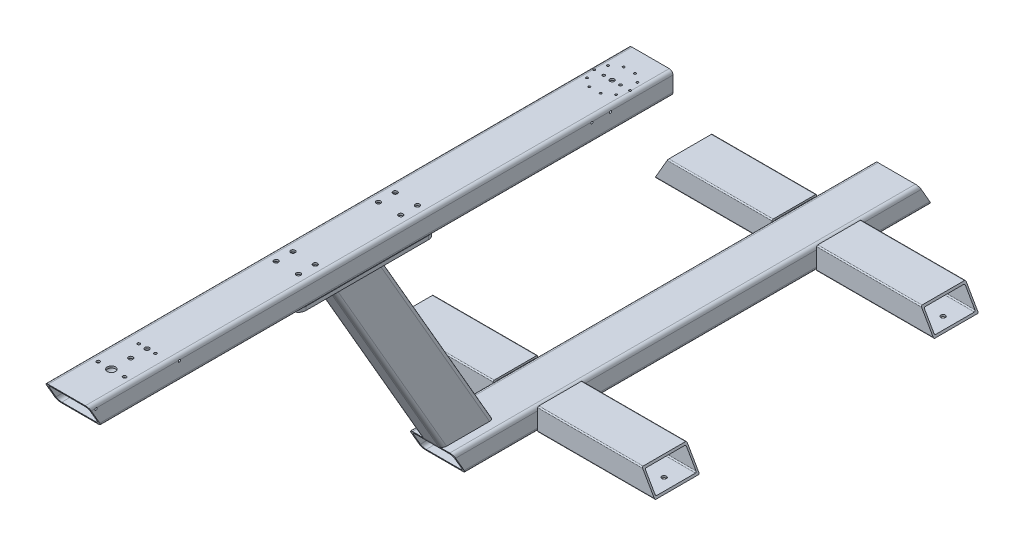
from build123d import *
from build123d.topology import SkipClean

# Parameters (mm, degrees)
CUSTOM_START                               = -800
CUSTOM_TUBE_RECTANGLE_120_60_5_1_DEPTH     = 1286.602540378
CUSTOM_START_2                             = -437
CUSTOM_TUBE_RECTANGLE_120_60_5_1_2_OUTLI_W = 122
CUSTOM_TUBE_RECTANGLE_120_60_5_1_2_OUTLI_H = 73
CUSTOM_TUBE_RECTANGLE_120_60_5_1_2_DEPTH   = 30.589838486
CUSTOM_START_3                             = -103.589838486
CUSTOM_TUBE_RECTANGLE_120_60_5_1_3_DEPTH   = 1570
CUSTOM_START_4                             = 269.282032303
CUSTOM_TUBE_RECTANGLE_120_60_5_1_4_DEPTH   = 554.256258422
CUSTOM_START_5                             = 200
CUSTOM_TUBE_RECTANGLE_120_60_5_1_5_DEPTH   = 69.282032303
CUSTOM_START_6                             = 823.538290725
CUSTOM_TUBE_RECTANGLE_120_60_5_1_6_DEPTH   = 69.282032303
CUSTOM_START_7                             = -31
CUSTOM_TUBE_RECTANGLE_120_60_5_1_7_OUTLI_W = 62
CUSTOM_TUBE_RECTANGLE_120_60_5_1_7_OUTLI_H = 453
CUSTOM_TUBE_RECTANGLE_120_60_5_1_7_DEPTH   = 61
CUSTOM_START_8                             = 570
CUSTOM_TUBE_RECTANGLE_120_60_5_1_8_OUTLI_W = 62
CUSTOM_TUBE_RECTANGLE_120_60_5_1_8_OUTLI_H = 453
CUSTOM_TUBE_RECTANGLE_120_60_5_1_8_DEPTH   = 61
CUSTOM_START_9                             = 199
CUSTOM_TUBE_RECTANGLE_120_60_5_1_9_DEPTH   = 695
CUSTOM_TUBE_RECTANGLE_120_60_5_2_DEPTH     = 750
CUSTOM_TUBE_RECTANGLE_120_60_5_2_2_DEPTH   = 750
AJUSTER_PROLONGER2_START                   = -60
AJUSTER_PROLONGER2_DEPTH                   = 435
AJUSTER_PROLONGER2_START_2                 = 60
AJUSTER_PROLONGER2_2_DEPTH                 = 315
AJUSTER_PROLONGER2_3_DEPTH                 = 435
AJUSTER_PROLONGER2_4_DEPTH                 = 315
ENL_V_MAT_EXTRU_1_DEPTH                    = 1640.476673146
ENL_V_MAT_EXTRU_1_DEPTH_BACK               = 1640.476673146
ENL_V_MAT_EXTRU_2_DEPTH                    = 1655.232076158
ENL_V_MAT_EXTRU_2_DEPTH_BACK               = 1655.232076158
ENL_V_MAT_EXTRU_3_DEPTH                    = 190
BOSS_EXTRU_1_DEPTH                         = 10
AJUSTER_PROLONGER3_START                   = 560
AJUSTER_PROLONGER3_OUTLINE_W               = 62
AJUSTER_PROLONGER3_OUTLINE_H               = 147
AJUSTER_PROLONGER3_DEPTH                   = 10
D_GAGEMENT_M51_AT_2_COUNT                  = 2
D_GAGEMENT_M51_AT_2_PITCH                  = 29.971251069
D_GAGEMENT_M51_AT_3_COUNT                  = 2
D_GAGEMENT_M51_AT_3_PITCH                  = 29.971251069
D_GAGEMENT_M51_AT_4_COUNT                  = 2
D_GAGEMENT_M51_AT_4_PITCH                  = 78.465753985
D_GAGEMENT_M51_AT_5_COUNT                  = 2
D_GAGEMENT_M51_AT_5_PITCH                  = 92.242026005
D_GAGEMENT_M51_AT_6_COUNT                  = 2
D_GAGEMENT_M51_AT_6_PITCH                  = 78.465753985
D_GAGEMENT_M51_AT_7_COUNT                  = 2
D_GAGEMENT_M51_AT_7_PITCH                  = 57.008707262
D_GAGEMENT_M51_AT_8_COUNT                  = 2
D_GAGEMENT_M51_AT_8_PITCH                  = 96.989005831
D_GAGEMENT_M51_AT_9_COUNT                  = 2
D_GAGEMENT_M51_AT_9_PITCH                  = 92.242026005
D_GAGEMENT_M51_AT_10_COUNT                 = 2
D_GAGEMENT_M51_AT_10_PITCH                 = 57.008707262
ESQUISSE114_R                              = 6
ENL_V_MAT_EXTRU_4_DEPTH                    = 145
ENL_V_MAT_EXTRU_5_DEPTH                    = 1652.237039945
ENL_V_MAT_EXTRU_5_DEPTH_BACK               = 1652.237039945
ESQUISSE115_R                              = 11
ESQUISSE116_R                              = 4.5
ENL_V_MAT_EXTRU_6_DEPTH                    = 140
D_GAGEMENT_START                           = -30
D_GAGEMENT_M101_OUTLINE_R                  = 6
D_GAGEMENT_M101_DEPTH                      = 5
D_GAGEMENT_M101_2_OUTLINE_R                = 6
D_GAGEMENT_M101_2_DEPTH                    = 5
D_GAGEMENT_M101_3_OUTLINE_R                = 6
D_GAGEMENT_M101_3_DEPTH                    = 5
D_GAGEMENT_M101_4_OUTLINE_R                = 6
D_GAGEMENT_M101_4_DEPTH                    = 5
D_GAGEMENT_START_2                         = 559
D_GAGEMENT_M102_OUTLINE_R                  = 6
D_GAGEMENT_M102_DEPTH                      = 12
D_GAGEMENT_START_3                         = 569
D_GAGEMENT_M102_2_OUTLINE_R                = 6
D_GAGEMENT_M102_2_DEPTH                    = 62
ENL_V_MAT_EXTRU_7_DEPTH                    = 15
ENL_V_MAT_EXTRU_8_DEPTH                    = 15
D_GAGEMENT_M61_AT_2_COUNT                  = 2
D_GAGEMENT_M61_AT_2_PITCH                  = 45
ESQUISSE125_R                              = 3.51
ESQUISSE125_R_2                            = 6
ENL_V_MAT_EXTRU_9_DEPTH                    = 1652.237039945
ESQUISSE126_R                              = 3
ENL_V_MAT_EXTRU_10_DEPTH                   = 1657.353755153
ESQUISSE127_R                              = 3
ENL_V_MAT_EXTRU_11_DEPTH                   = 1657.353755153


with BuildPart() as part:
    # Custom TUBE-RECTANGLE-120-60-5(1): read off the stored shape, not the designer's step
    # Custom TUBE-RECTANGLE-120-60-5(1) outline → Custom TUBE-RECTANGLE-120-60-5(1) (new body)
    with BuildSketch(Plane.XY.offset(CUSTOM_START)):
        with BuildLine():
            ThreePointArc((50, -30), (57.071067812, -27.071067812), (60, -20))
            Line((60, -20), (60, 20))
            ThreePointArc((60, 20), (57.071067812, 27.071067812), (50, 30))
            Line((50, 30), (-50, 30))
            ThreePointArc((-50, 30), (-57.071067812, 27.071067812), (-60, 20))
            Line((-60, 20), (-60, -20))
            ThreePointArc((-60, -20), (-57.071067812, -27.071067812), (-50, -30))
            Line((-50, -30), (50, -30))
        make_face()
        with BuildLine():
            Line((55, 15), (55, -15))
            ThreePointArc((55, -15), (52.071067812, -22.071067812), (45, -25))
            Line((45, -25), (-45, -25))
            ThreePointArc((-45, -25), (-52.071067812, -22.071067812), (-55, -15))
            Line((-55, -15), (-55, 15))
            ThreePointArc((-55, 15), (-52.071067812, 22.071067812), (-45, 25))
            Line((-45, 25), (45, 25))
            ThreePointArc((45, 25), (52.071067812, 22.071067812), (55, 15))
        make_face(mode=Mode.SUBTRACT)
    extrude(amount=CUSTOM_TUBE_RECTANGLE_120_60_5_1_DEPTH)

    # Custom TUBE-RECTANGLE-120-60-5_1 2 outli → Custom TUBE-RECTANGLE-120-60-5_1 2 (cut)
    with BuildSketch(Plane(origin=(0, 0, 0), x_dir=(1, 0, 0), z_dir=(0, 0.49999999999999795, -0.8660254037844399)).offset(CUSTOM_START_2)):
        with Locations((0, -234.5)):
            Rectangle(CUSTOM_TUBE_RECTANGLE_120_60_5_1_2_OUTLI_W, CUSTOM_TUBE_RECTANGLE_120_60_5_1_2_OUTLI_H)
    extrude(amount=CUSTOM_TUBE_RECTANGLE_120_60_5_1_2_DEPTH, mode=Mode.SUBTRACT)

    # Esquisse18 → Enlèv. mat.-Extru.3 (cut)
    with BuildSketch(Plane(origin=(60, 0, 0), x_dir=(0, 0, -1), z_dir=(1, 0, 0))):
        Polygon((800, -30), (695.221591593, 151.481526898), (800, 151.481526898), align=None)
    extrude(amount=-ENL_V_MAT_EXTRU_3_DEPTH, mode=Mode.SUBTRACT)

    # Esquisse122 → Enlèv. mat.-Extru.8 (cut)
    with BuildSketch(Plane(origin=(0, 30, 0), x_dir=(1, 0, 0), z_dir=(0, 1, 0))):
        with BuildLine():
            Line((20, -382.320508076), (20, -452.320508076))
            ThreePointArc((20, -452.320508076), (0, -472.320508076), (-20, -452.320508076))
            Line((-20, -452.320508076), (-20, -382.320508076))
            ThreePointArc((-20, -382.320508076), (0, -362.320508076), (20, -382.320508076))
        make_face()
    extrude(amount=-ENL_V_MAT_EXTRU_8_DEPTH, mode=Mode.SUBTRACT)


with BuildPart() as body_2:
    # Custom TUBE-RECTANGLE-120-60-5_1 3 outli → Custom TUBE-RECTANGLE-120-60-5_1 3 (new body)
    with BuildSketch(Plane.XY.offset(CUSTOM_START_3)):
        with BuildLine():
            ThreePointArc((50, 570), (57.071067812, 572.928932188), (60, 580))
            Line((60, 580), (60, 620))
            ThreePointArc((60, 620), (57.071067812, 627.071067812), (50, 630))
            Line((50, 630), (-50, 630))
            ThreePointArc((-50, 630), (-57.071067812, 627.071067812), (-60, 620))
            Line((-60, 620), (-60, 580))
            ThreePointArc((-60, 580), (-57.071067812, 572.928932188), (-50, 570))
            Line((-50, 570), (50, 570))
        make_face()
        with BuildLine():
            Line((55, 615), (55, 585))
            ThreePointArc((55, 585), (52.071067812, 577.928932188), (45, 575))
            Line((45, 575), (-45, 575))
            ThreePointArc((-45, 575), (-52.071067812, 577.928932188), (-55, 585))
            Line((-55, 585), (-55, 615))
            ThreePointArc((-55, 615), (-52.071067812, 622.071067812), (-45, 625))
            Line((-45, 625), (45, 625))
            ThreePointArc((45, 625), (52.071067812, 622.071067812), (55, 615))
        make_face(mode=Mode.SUBTRACT)
    extrude(amount=CUSTOM_TUBE_RECTANGLE_120_60_5_1_3_DEPTH)

    # Esquisse17 → Enlèv. mat.-Extru.2 (cut, two sides: drawn at the far end of the back side and taken through both)
    with BuildSketch(Plane(origin=(60, 0, 0), x_dir=(0, 0, -1), z_dir=(1, 0, 0)).offset(-ENL_V_MAT_EXTRU_2_DEPTH_BACK)):
        Polygon((-1466.410161514, 630), (-1420.174971985, 549.918302638), (-1466.410161514, 549.918302638), align=None)
    extrude(amount=ENL_V_MAT_EXTRU_2_DEPTH + ENL_V_MAT_EXTRU_2_DEPTH_BACK, mode=Mode.SUBTRACT)

    # Esquisse113 → Dégagement M51 (revolve, cut)
    with BuildSketch(Plane(origin=(48.494502916, 648.6, 0), x_dir=(0, 0, 1), z_dir=(1, 0, 0))):
        Polygon((0, 0), (0, 91.742495795), (2.9, 90), (2.9, 0), align=None)
    d_gagement_m51 = revolve(axis=Axis((48.494502916, 654.95, 0), (0, -1, 0)), mode=Mode.SUBTRACT)

    # Dégagement M51 at 2: Dégagement M51 ×2
    with Locations(*[Vector(-0.30901699437495195, 0, 0.9510565162951522) * (i * D_GAGEMENT_M51_AT_2_PITCH) for i in range(1, D_GAGEMENT_M51_AT_2_COUNT)]):
        add(d_gagement_m51, mode=Mode.SUBTRACT)

    # Dégagement M51 at 3: Dégagement M51 ×2
    with Locations(*[Vector(-0.30901699437494484, 0, -0.9510565162951545) * (i * D_GAGEMENT_M51_AT_3_PITCH) for i in range(1, D_GAGEMENT_M51_AT_3_COUNT)]):
        add(d_gagement_m51, mode=Mode.SUBTRACT)

    # Dégagement M51 at 4: Dégagement M51 ×2
    with Locations(*[Vector(-0.8090169943749466, 0, -0.5877852522924744) * (i * D_GAGEMENT_M51_AT_4_PITCH) for i in range(1, D_GAGEMENT_M51_AT_4_COUNT)]):
        add(d_gagement_m51, mode=Mode.SUBTRACT)

    # Dégagement M51 at 5: Dégagement M51 ×2
    with Locations(*[Vector(-0.9510565162951534, 0, -0.3090169943749481) * (i * D_GAGEMENT_M51_AT_5_PITCH) for i in range(1, D_GAGEMENT_M51_AT_5_COUNT)]):
        add(d_gagement_m51, mode=Mode.SUBTRACT)

    # Dégagement M51 at 6: Dégagement M51 ×2
    with Locations(*[Vector(-0.8090169943749508, 0, 0.5877852522924686) * (i * D_GAGEMENT_M51_AT_6_PITCH) for i in range(1, D_GAGEMENT_M51_AT_6_COUNT)]):
        add(d_gagement_m51, mode=Mode.SUBTRACT)

    # Dégagement M51 at 7: Dégagement M51 ×2
    with Locations(*[Vector(-0.587785252292477, 0, 0.8090169943749446) * (i * D_GAGEMENT_M51_AT_7_PITCH) for i in range(1, D_GAGEMENT_M51_AT_7_COUNT)]):
        add(d_gagement_m51, mode=Mode.SUBTRACT)

    # Dégagement M51 at 8: Dégagement M51 ×2
    with Locations(*[(-i * D_GAGEMENT_M51_AT_8_PITCH, 0, 0) for i in range(1, D_GAGEMENT_M51_AT_8_COUNT)]):
        add(d_gagement_m51, mode=Mode.SUBTRACT)

    # Dégagement M51 at 9: Dégagement M51 ×2
    with Locations(*[Vector(-0.9510565162951556, 0, 0.3090169943749412) * (i * D_GAGEMENT_M51_AT_9_PITCH) for i in range(1, D_GAGEMENT_M51_AT_9_COUNT)]):
        add(d_gagement_m51, mode=Mode.SUBTRACT)

    # Dégagement M51 at 10: Dégagement M51 ×2
    with Locations(*[Vector(-0.5877852522924712, 0, -0.8090169943749488) * (i * D_GAGEMENT_M51_AT_10_PITCH) for i in range(1, D_GAGEMENT_M51_AT_10_COUNT)]):
        add(d_gagement_m51, mode=Mode.SUBTRACT)

    # Esquisse114 → Enlèv. mat.-Extru.4 (cut)
    with BuildSketch(Plane(origin=(0, 661, 0), x_dir=(1, 0, 0), z_dir=(0, 1, 0))):
        with Locations(Location((0, 0, 0), (0, 0, 270))):
            Circle(ESQUISSE114_R)
    extrude(amount=-ENL_V_MAT_EXTRU_4_DEPTH, mode=Mode.SUBTRACT)

    # Esquisse115 → Enlèv. mat.-Extru.5 (cut, two sides: drawn at the far end of the back side and taken through both)
    with BuildSketch(Plane(origin=(0, 630, 0), x_dir=(1, 0, 0), z_dir=(0, 1, 0)).offset(-ENL_V_MAT_EXTRU_5_DEPTH_BACK)):
        with Locations(Location((0, -1346.410161514, 0), (0, 0, 270))):
            Circle(ESQUISSE115_R)
    extrude(amount=ENL_V_MAT_EXTRU_5_DEPTH + ENL_V_MAT_EXTRU_5_DEPTH_BACK, mode=Mode.SUBTRACT)

    # Esquisse116 → Enlèv. mat.-Extru.6 (cut)
    with BuildSketch(Plane.XZ.offset(-562)):
        with Locations(Location((35.5, 1346.410161514, 0), (0, 0, 90))):
            Circle(ESQUISSE116_R)
        with Locations(Location((-35.5, 1346.410161514, 0), (0, 0, 90))):
            Circle(ESQUISSE116_R)
    extrude(amount=-ENL_V_MAT_EXTRU_6_DEPTH, mode=Mode.SUBTRACT)

    # D_gagement M102 2 outline → D_gagement M102 2 (cut)
    with BuildSketch(Plane(origin=(0, 0, 0), x_dir=(1, 0, 0), z_dir=(0, 1, 0)).offset(D_GAGEMENT_START_3)):
        with Locations((30, -553.316150746)):
            Circle(D_GAGEMENT_M102_2_OUTLINE_R)
        with Locations((-30, -873.316150746)):
            Circle(D_GAGEMENT_M102_2_OUTLINE_R)
        with Locations((30, -873.316150746)):
            Circle(D_GAGEMENT_M102_2_OUTLINE_R)
        with Locations((-30, -553.316150746)):
            Circle(D_GAGEMENT_M102_2_OUTLINE_R)
        with Locations((30, -598.316150746)):
            Circle(D_GAGEMENT_M102_2_OUTLINE_R)
        with Locations((-30, -828.316150746)):
            Circle(D_GAGEMENT_M102_2_OUTLINE_R)
        with Locations((30, -828.316150746)):
            Circle(D_GAGEMENT_M102_2_OUTLINE_R)
        with Locations((-30, -598.316150746)):
            Circle(D_GAGEMENT_M102_2_OUTLINE_R)
    extrude(amount=D_GAGEMENT_M102_2_DEPTH, mode=Mode.SUBTRACT)


with BuildPart() as body_3:
    # Custom TUBE-RECTANGLE-120-60-5_1 4 outli → Custom TUBE-RECTANGLE-120-60-5_1 4 (new body)
    with BuildSketch(Plane(origin=(0, 0, 0), x_dir=(1, 0, 0), z_dir=(0, 0.8660254037844399, 0.49999999999999795)).offset(CUSTOM_START_4)):
        with BuildLine():
            Line((-30, -296.410161514), (-30, -396.410161514))
            ThreePointArc((-30, -396.410161514), (-27.071067812, -403.481229326), (-20, -406.410161514))
            Line((-20, -406.410161514), (20, -406.410161514))
            ThreePointArc((20, -406.410161514), (27.071067812, -403.481229326), (30, -396.410161514))
            Line((30, -396.410161514), (30, -296.410161514))
            ThreePointArc((30, -296.410161514), (27.071067812, -289.339093702), (20, -286.410161514))
            Line((20, -286.410161514), (-20, -286.410161514))
            ThreePointArc((-20, -286.410161514), (-27.071067812, -289.339093702), (-30, -296.410161514))
        make_face()
        with BuildLine():
            ThreePointArc((25, -391.410161514), (22.071067812, -398.481229326), (15, -401.410161514))
            Line((15, -401.410161514), (-15, -401.410161514))
            ThreePointArc((-15, -401.410161514), (-22.071067812, -398.481229326), (-25, -391.410161514))
            Line((-25, -391.410161514), (-25, -301.410161514))
            ThreePointArc((-25, -301.410161514), (-22.071067812, -294.339093702), (-15, -291.410161514))
            Line((-15, -291.410161514), (15, -291.410161514))
            ThreePointArc((15, -291.410161514), (22.071067812, -294.339093702), (25, -301.410161514))
            Line((25, -301.410161514), (25, -391.410161514))
        make_face(mode=Mode.SUBTRACT)
    extrude(amount=CUSTOM_TUBE_RECTANGLE_120_60_5_1_4_DEPTH)

    # Custom TUBE-RECTANGLE-120-60-5_1 5 outli → Custom TUBE-RECTANGLE-120-60-5_1 5 (add)
    with BuildSketch(Plane(origin=(0, 0, 0), x_dir=(1, 0, 0), z_dir=(0, 0.8660254037844399, 0.49999999999999795)).offset(CUSTOM_START_5)):
        with BuildLine():
            Line((-30, -296.410161514), (-30, -396.410161514))
            ThreePointArc((-30, -396.410161514), (-27.071067812, -403.481229326), (-20, -406.410161514))
            Line((-20, -406.410161514), (20, -406.410161514))
            ThreePointArc((20, -406.410161514), (27.071067812, -403.481229326), (30, -396.410161514))
            Line((30, -396.410161514), (30, -296.410161514))
            ThreePointArc((30, -296.410161514), (27.071067812, -289.339093702), (20, -286.410161514))
            Line((20, -286.410161514), (-20, -286.410161514))
            ThreePointArc((-20, -286.410161514), (-27.071067812, -289.339093702), (-30, -296.410161514))
        make_face()
    extrude(amount=CUSTOM_TUBE_RECTANGLE_120_60_5_1_5_DEPTH)

    # Custom TUBE-RECTANGLE-120-60-5_1 6 outli → Custom TUBE-RECTANGLE-120-60-5_1 6 (add)
    with BuildSketch(Plane(origin=(0, 0, 0), x_dir=(1, 0, 0), z_dir=(0, 0.8660254037844399, 0.49999999999999795)).offset(CUSTOM_START_6)):
        with BuildLine():
            Line((-30, -296.410161514), (-30, -396.410161514))
            ThreePointArc((-30, -396.410161514), (-27.071067812, -403.481229326), (-20, -406.410161514))
            Line((-20, -406.410161514), (20, -406.410161514))
            ThreePointArc((20, -406.410161514), (27.071067812, -403.481229326), (30, -396.410161514))
            Line((30, -396.410161514), (30, -296.410161514))
            ThreePointArc((30, -296.410161514), (27.071067812, -289.339093702), (20, -286.410161514))
            Line((20, -286.410161514), (-20, -286.410161514))
            ThreePointArc((-20, -286.410161514), (-27.071067812, -289.339093702), (-30, -296.410161514))
        make_face()
    extrude(amount=CUSTOM_TUBE_RECTANGLE_120_60_5_1_6_DEPTH)

    # Custom TUBE-RECTANGLE-120-60-5_1 7 outli → Custom TUBE-RECTANGLE-120-60-5_1 7 (cut)
    with BuildSketch(Plane(origin=(0, 0, 0), x_dir=(1, 0, 0), z_dir=(0, 1, 0)).offset(CUSTOM_START_7)):
        with Locations((0, -573.5)):
            Rectangle(CUSTOM_TUBE_RECTANGLE_120_60_5_1_7_OUTLI_W, CUSTOM_TUBE_RECTANGLE_120_60_5_1_7_OUTLI_H)
    extrude(amount=CUSTOM_TUBE_RECTANGLE_120_60_5_1_7_DEPTH, mode=Mode.SUBTRACT)

    # Custom TUBE-RECTANGLE-120-60-5_1 8 outli → Custom TUBE-RECTANGLE-120-60-5_1 8 (cut)
    with BuildSketch(Plane(origin=(0, 0, 0), x_dir=(1, 0, 0), z_dir=(0, 1, 0)).offset(CUSTOM_START_8)):
        with Locations((0, -573.5)):
            Rectangle(CUSTOM_TUBE_RECTANGLE_120_60_5_1_8_OUTLI_W, CUSTOM_TUBE_RECTANGLE_120_60_5_1_8_OUTLI_H)
    extrude(amount=CUSTOM_TUBE_RECTANGLE_120_60_5_1_8_DEPTH, mode=Mode.SUBTRACT)

    # Custom TUBE-RECTANGLE-120-60-5_1 9 outli → Custom TUBE-RECTANGLE-120-60-5_1 9 (cut)
    with SkipClean():  # the faces are left unmerged after this step: merging them gives an invalid solid
        with BuildSketch(Plane(origin=(0, 0, 0), x_dir=(1, 0, 0), z_dir=(0, 0.8660254037844399, 0.49999999999999795)).offset(CUSTOM_START_9)):
            with BuildLine():
                Line((-15, -401.410161514), (15, -401.410161514))
                ThreePointArc((15, -401.410161514), (22.071067812, -398.481229326), (25, -391.410161514))
                Line((25, -391.410161514), (25, -301.410161514))
                ThreePointArc((25, -301.410161514), (22.071067812, -294.339093702), (15, -291.410161514))
                Line((15, -291.410161514), (-15, -291.410161514))
                ThreePointArc((-15, -291.410161514), (-22.071067812, -294.339093702), (-25, -301.410161514))
                Line((-25, -301.410161514), (-25, -391.410161514))
                ThreePointArc((-25, -391.410161514), (-22.071067812, -398.481229326), (-15, -401.410161514))
            make_face()
        extrude(amount=CUSTOM_TUBE_RECTANGLE_120_60_5_1_9_DEPTH, mode=Mode.SUBTRACT)
    add(body_3.part.scale(1), mode=Mode.REPLACE)  # the faces are merged on a copy

    # Ajuster/Prolonger3: read off the stored shape, not the designer's step
    # Ajuster/Prolonger3 outline → Ajuster/Prolonger3 (cut)
    with BuildSketch(Plane(origin=(0, 0, 0), x_dir=(1, 0, 0), z_dir=(0, 1, 0)).offset(AJUSTER_PROLONGER3_START)):
        with Locations((0, -726.5)):
            Rectangle(AJUSTER_PROLONGER3_OUTLINE_W, AJUSTER_PROLONGER3_OUTLINE_H)
    extrude(amount=AJUSTER_PROLONGER3_DEPTH, mode=Mode.SUBTRACT)


with BuildPart() as body_4:
    # Esquisse112 → Custom TUBE-RECTANGLE-120-60-5(2) (new body)
    with BuildSketch(Plane(origin=(375, 0, 200), x_dir=(0, 0, 1), z_dir=(-1, 0, 0))):
        with BuildLine():
            Line((-57, -30), (57, -30))
            ThreePointArc((57, -30), (59.121320344, -29.121320344), (60, -27))
            Line((60, -27), (60, 27))
            ThreePointArc((60, 27), (59.121320344, 29.121320344), (57, 30))
            Line((57, 30), (-57, 30))
            ThreePointArc((-57, 30), (-59.121320344, 29.121320344), (-60, 27))
            Line((-60, 27), (-60, -27))
            ThreePointArc((-60, -27), (-59.121320344, -29.121320344), (-57, -30))
        make_face()
        with BuildLine():
            Line((-52, -25), (52, -25))
            ThreePointArc((52, -25), (54.121320344, -24.121320344), (55, -22))
            Line((55, -22), (55, 22))
            ThreePointArc((55, 22), (54.121320344, 24.121320344), (52, 25))
            Line((52, 25), (-52, 25))
            ThreePointArc((-52, 25), (-54.121320344, 24.121320344), (-55, 22))
            Line((-55, 22), (-55, -22))
            ThreePointArc((-55, -22), (-54.121320344, -24.121320344), (-52, -25))
        make_face(mode=Mode.SUBTRACT)
    extrude(amount=CUSTOM_TUBE_RECTANGLE_120_60_5_2_DEPTH)

    # Ajuster_Prolonger2 3 outline → Ajuster_Prolonger2 3 (cut)
    with BuildSketch(Plane.YZ.offset(AJUSTER_PROLONGER2_START)):
        with BuildLine():
            Line((27, 260), (-27, 260))
            ThreePointArc((-27, 260), (-29.121320344, 259.121320344), (-30, 257))
            Line((-30, 257), (-30, 143))
            ThreePointArc((-30, 143), (-29.121320344, 140.878679656), (-27, 140))
            Line((-27, 140), (27, 140))
            ThreePointArc((27, 140), (29.121320344, 140.878679656), (30, 143))
            Line((30, 143), (30, 257))
            ThreePointArc((30, 257), (29.121320344, 259.121320344), (27, 260))
        make_face()
        with BuildLine():
            ThreePointArc((-25, 252), (-24.121320344, 254.121320344), (-22, 255))
            Line((-22, 255), (22, 255))
            ThreePointArc((22, 255), (24.121320344, 254.121320344), (25, 252))
            Line((25, 252), (25, 148))
            ThreePointArc((25, 148), (24.121320344, 145.878679656), (22, 145))
            Line((22, 145), (-22, 145))
            ThreePointArc((-22, 145), (-24.121320344, 145.878679656), (-25, 148))
            Line((-25, 148), (-25, 252))
        make_face(mode=Mode.SUBTRACT)
    extrude(amount=AJUSTER_PROLONGER2_3_DEPTH, mode=Mode.SUBTRACT)


with BuildPart() as body_5:
    # Esquisse112 on segment 2 (carried to segment 2) → Custom TUBE-RECTANGLE-120-60-5_2 2 (new body)
    with BuildSketch(Plane(origin=(375, 0, -550), x_dir=(0, 0, 1), z_dir=(-1, 0, 0))):
        with BuildLine():
            Line((-57, -30), (57, -30))
            ThreePointArc((57, -30), (59.121320344, -29.121320344), (60, -27))
            Line((60, -27), (60, 27))
            ThreePointArc((60, 27), (59.121320344, 29.121320344), (57, 30))
            Line((57, 30), (-57, 30))
            ThreePointArc((-57, 30), (-59.121320344, 29.121320344), (-60, 27))
            Line((-60, 27), (-60, -27))
            ThreePointArc((-60, -27), (-59.121320344, -29.121320344), (-57, -30))
        make_face()
        with BuildLine():
            Line((-52, -25), (52, -25))
            ThreePointArc((52, -25), (54.121320344, -24.121320344), (55, -22))
            Line((55, -22), (55, 22))
            ThreePointArc((55, 22), (54.121320344, 24.121320344), (52, 25))
            Line((52, 25), (-52, 25))
            ThreePointArc((-52, 25), (-54.121320344, 24.121320344), (-55, 22))
            Line((-55, 22), (-55, -22))
            ThreePointArc((-55, -22), (-54.121320344, -24.121320344), (-52, -25))
        make_face(mode=Mode.SUBTRACT)
    extrude(amount=CUSTOM_TUBE_RECTANGLE_120_60_5_2_2_DEPTH)

    # Ajuster/Prolonger2: read off the stored shape, not the designer's step
    # Ajuster/Prolonger2 outline → Ajuster/Prolonger2 (cut)
    with BuildSketch(Plane.YZ.offset(AJUSTER_PROLONGER2_START)):
        with BuildLine():
            Line((27, -490), (-27, -490))
            ThreePointArc((-27, -490), (-29.121320344, -490.878679656), (-30, -493))
            Line((-30, -493), (-30, -607))
            ThreePointArc((-30, -607), (-29.121320344, -609.121320344), (-27, -610))
            Line((-27, -610), (27, -610))
            ThreePointArc((27, -610), (29.121320344, -609.121320344), (30, -607))
            Line((30, -607), (30, -493))
            ThreePointArc((30, -493), (29.121320344, -490.878679656), (27, -490))
        make_face()
        with BuildLine():
            ThreePointArc((-25, -498), (-24.121320344, -495.878679656), (-22, -495))
            Line((-22, -495), (22, -495))
            ThreePointArc((22, -495), (24.121320344, -495.878679656), (25, -498))
            Line((25, -498), (25, -602))
            ThreePointArc((25, -602), (24.121320344, -604.121320344), (22, -605))
            Line((22, -605), (-22, -605))
            ThreePointArc((-22, -605), (-24.121320344, -604.121320344), (-25, -602))
            Line((-25, -602), (-25, -498))
        make_face(mode=Mode.SUBTRACT)
    extrude(amount=AJUSTER_PROLONGER2_DEPTH, mode=Mode.SUBTRACT)


with BuildPart() as body_6:
    # Ajuster_Prolonger2 2 outline → Ajuster_Prolonger2 2 (new body)
    with BuildSketch(Plane.YZ.offset(AJUSTER_PROLONGER2_START_2)):
        with BuildLine():
            Line((27, -490), (-27, -490))
            ThreePointArc((-27, -490), (-29.121320344, -490.878679656), (-30, -493))
            Line((-30, -493), (-30, -607))
            ThreePointArc((-30, -607), (-29.121320344, -609.121320344), (-27, -610))
            Line((-27, -610), (27, -610))
            ThreePointArc((27, -610), (29.121320344, -609.121320344), (30, -607))
            Line((30, -607), (30, -493))
            ThreePointArc((30, -493), (29.121320344, -490.878679656), (27, -490))
        make_face()
        with BuildLine():
            ThreePointArc((-25, -498), (-24.121320344, -495.878679656), (-22, -495))
            Line((-22, -495), (22, -495))
            ThreePointArc((22, -495), (24.121320344, -495.878679656), (25, -498))
            Line((25, -498), (25, -602))
            ThreePointArc((25, -602), (24.121320344, -604.121320344), (22, -605))
            Line((22, -605), (-22, -605))
            ThreePointArc((-22, -605), (-24.121320344, -604.121320344), (-25, -602))
            Line((-25, -602), (-25, -498))
        make_face(mode=Mode.SUBTRACT)
    extrude(amount=AJUSTER_PROLONGER2_2_DEPTH)


with BuildPart() as body_7:
    # Ajuster_Prolonger2 4 outline → Ajuster_Prolonger2 4 (new body)
    with BuildSketch(Plane.YZ.offset(AJUSTER_PROLONGER2_START_2)):
        with BuildLine():
            Line((27, 260), (-27, 260))
            ThreePointArc((-27, 260), (-29.121320344, 259.121320344), (-30, 257))
            Line((-30, 257), (-30, 143))
            ThreePointArc((-30, 143), (-29.121320344, 140.878679656), (-27, 140))
            Line((-27, 140), (27, 140))
            ThreePointArc((27, 140), (29.121320344, 140.878679656), (30, 143))
            Line((30, 143), (30, 257))
            ThreePointArc((30, 257), (29.121320344, 259.121320344), (27, 260))
        make_face()
        with BuildLine():
            ThreePointArc((-25, 252), (-24.121320344, 254.121320344), (-22, 255))
            Line((-22, 255), (22, 255))
            ThreePointArc((22, 255), (24.121320344, 254.121320344), (25, 252))
            Line((25, 252), (25, 148))
            ThreePointArc((25, 148), (24.121320344, 145.878679656), (22, 145))
            Line((22, 145), (-22, 145))
            ThreePointArc((-22, 145), (-24.121320344, 145.878679656), (-25, 148))
            Line((-25, 148), (-25, 252))
        make_face(mode=Mode.SUBTRACT)
    extrude(amount=AJUSTER_PROLONGER2_4_DEPTH)


with BuildPart() as enl_v_mat_extru_1_tool:
    # Esquisse15 → Enlèv. mat.-Extru.1 (new, two sides: drawn at the far end of the back side and taken through both)
    with BuildSketch(Plane.XY.offset(-ENL_V_MAT_EXTRU_1_DEPTH_BACK)):
        Polygon((375, -30), (317.264973081, 70), (375, 70), align=None)
        Polygon((-375, 70), (-375, -30), (-317.264973081, 70), align=None)
    extrude(amount=ENL_V_MAT_EXTRU_1_DEPTH + ENL_V_MAT_EXTRU_1_DEPTH_BACK)


with BuildPart() as body_4_1:
    add(body_4.part)

    # Enlèv. mat.-Extru.1: cut by enl_v_mat_extru_1_tool
    add(enl_v_mat_extru_1_tool.part, mode=Mode.SUBTRACT)

    # D_gagement M101 3 outline → D_gagement M101 3 (cut)
    with BuildSketch(Plane(origin=(0, 0, 0), x_dir=(1, 0, 0), z_dir=(0, 1, 0)).offset(D_GAGEMENT_START)):
        with Locations((-340, -200)):
            Circle(D_GAGEMENT_M101_3_OUTLINE_R)
    extrude(amount=D_GAGEMENT_M101_3_DEPTH, mode=Mode.SUBTRACT)


with BuildPart() as body_5_1:
    add(body_5.part)

    # Enlèv. mat.-Extru.1: cut by enl_v_mat_extru_1_tool
    add(enl_v_mat_extru_1_tool.part, mode=Mode.SUBTRACT)

    # Dégagement M101: read off the stored shape, not the designer's step
    # Dégagement M101 outline → Dégagement M101 (cut)
    with BuildSketch(Plane(origin=(0, 0, 0), x_dir=(1, 0, 0), z_dir=(0, 1, 0)).offset(D_GAGEMENT_START)):
        with Locations((-340, 550)):
            Circle(D_GAGEMENT_M101_OUTLINE_R)
    extrude(amount=D_GAGEMENT_M101_DEPTH, mode=Mode.SUBTRACT)


with BuildPart() as body_6_1:
    add(body_6.part)

    # Enlèv. mat.-Extru.1: cut by enl_v_mat_extru_1_tool
    add(enl_v_mat_extru_1_tool.part, mode=Mode.SUBTRACT)

    # D_gagement M101 2 outline → D_gagement M101 2 (cut)
    with BuildSketch(Plane(origin=(0, 0, 0), x_dir=(1, 0, 0), z_dir=(0, 1, 0)).offset(D_GAGEMENT_START)):
        with Locations((340, 550)):
            Circle(D_GAGEMENT_M101_2_OUTLINE_R)
    extrude(amount=D_GAGEMENT_M101_2_DEPTH, mode=Mode.SUBTRACT)


with BuildPart() as body_7_1:
    add(body_7.part)

    # Enlèv. mat.-Extru.1: cut by enl_v_mat_extru_1_tool
    add(enl_v_mat_extru_1_tool.part, mode=Mode.SUBTRACT)

    # D_gagement M101 4 outline → D_gagement M101 4 (cut)
    with BuildSketch(Plane(origin=(0, 0, 0), x_dir=(1, 0, 0), z_dir=(0, 1, 0)).offset(D_GAGEMENT_START)):
        with Locations((340, -200)):
            Circle(D_GAGEMENT_M101_4_OUTLINE_R)
    extrude(amount=D_GAGEMENT_M101_4_DEPTH, mode=Mode.SUBTRACT)


with BuildPart() as body_8:
    # Esquisse19 → Boss.-Extru.1 (new body)
    with BuildSketch(Plane(origin=(0, 570, -560), x_dir=(1, 0, 0), z_dir=(0, -1, 0))):
        with BuildLine():
            Line((35, 1088.371685741), (-35, 1088.371685741))
            ThreePointArc((-35, 1088.371685741), (-49.142135624, 1094.229550117), (-55, 1108.371685741))
            Line((-55, 1108.371685741), (-55, 1438.371685741))
            ThreePointArc((-55, 1438.371685741), (-49.142135624, 1452.513821365), (-35, 1458.371685741))
            Line((-35, 1458.371685741), (35, 1458.371685741))
            ThreePointArc((35, 1458.371685741), (49.142135624, 1452.513821365), (55, 1438.371685741))
            Line((55, 1438.371685741), (55, 1108.371685741))
            ThreePointArc((55, 1108.371685741), (49.142135624, 1094.229550117), (35, 1088.371685741))
        make_face()
    extrude(amount=BOSS_EXTRU_1_DEPTH)

    # Dégagement M102: read off the stored shape, not the designer's step
    # Dégagement M102 outline → Dégagement M102 (cut)
    with BuildSketch(Plane(origin=(0, 0, 0), x_dir=(1, 0, 0), z_dir=(0, 1, 0)).offset(D_GAGEMENT_START_2)):
        with Locations((30, -553.316150746)):
            Circle(D_GAGEMENT_M102_OUTLINE_R)
        with Locations((-30, -873.316150746)):
            Circle(D_GAGEMENT_M102_OUTLINE_R)
        with Locations((30, -873.316150746)):
            Circle(D_GAGEMENT_M102_OUTLINE_R)
        with Locations((-30, -553.316150746)):
            Circle(D_GAGEMENT_M102_OUTLINE_R)
        with Locations((30, -598.316150746)):
            Circle(D_GAGEMENT_M102_OUTLINE_R)
        with Locations((-30, -828.316150746)):
            Circle(D_GAGEMENT_M102_OUTLINE_R)
        with Locations((30, -828.316150746)):
            Circle(D_GAGEMENT_M102_OUTLINE_R)
        with Locations((-30, -598.316150746)):
            Circle(D_GAGEMENT_M102_OUTLINE_R)
    extrude(amount=D_GAGEMENT_M102_DEPTH, mode=Mode.SUBTRACT)


with BuildPart() as enl_v_mat_extru_7_tool:
    # Esquisse121 → Enlèv. mat.-Extru.7 (new body)
    with BuildSketch(Plane(origin=(0, 575, 0), x_dir=(1, 0, 0), z_dir=(0, 1, 0))):
        with BuildLine():
            Line((20, -688.316150746), (20, -758.316150746))
            ThreePointArc((20, -758.316150746), (0, -778.316150746), (-20, -758.316150746))
            Line((-20, -758.316150746), (-20, -688.316150746))
            ThreePointArc((-20, -688.316150746), (0, -668.316150746), (20, -688.316150746))
        make_face()
    extrude(amount=-ENL_V_MAT_EXTRU_7_DEPTH)


with BuildPart() as body_2_1:
    add(body_2.part)

    # Enlèv. mat.-Extru.7: cut by enl_v_mat_extru_7_tool
    add(enl_v_mat_extru_7_tool.part, mode=Mode.SUBTRACT)

    # Esquisse124 → Dégagement M61 (revolve, cut)
    with BuildSketch(Plane(origin=(22.5, 630, 0), x_dir=(0, 0, 1), z_dir=(1, 0, 0))):
        Polygon((0, 0), (0, 122.103012167), (3.5, 120), (3.5, 0), align=None)
    d_gagement_m61 = revolve(axis=Axis((22.5, 636.35, 0), (0, -1, 0)), mode=Mode.SUBTRACT)

    # Dégagement M61 at 2: Dégagement M61 ×2
    with Locations(*[(-i * D_GAGEMENT_M61_AT_2_PITCH, 0, 0) for i in range(1, D_GAGEMENT_M61_AT_2_COUNT)]):
        add(d_gagement_m61, mode=Mode.SUBTRACT)

    # Esquisse125 → Enlèv. mat.-Extru.9 (cut, through all)
    with BuildSketch(Plane(origin=(0, 630, 0), x_dir=(1, 0, 0), z_dir=(0, 1, 0))):
        with Locations(Location((-22.5, -1250.410161514, 0), (0, 0, 270))):
            Circle(ESQUISSE125_R)
        with Locations(Location((22.5, -1250.410161514, 0), (0, 0, 270))):
            Circle(ESQUISSE125_R)
        with Locations(Location((0, -1250.410161514, 0), (0, 0, 270))):
            Circle(ESQUISSE125_R_2)
        with Locations(Location((0, -1294.410161514, 0), (0, 0, 270))):
            Circle(ESQUISSE125_R_2)
    extrude(amount=-ENL_V_MAT_EXTRU_9_DEPTH, mode=Mode.SUBTRACT)

    # Esquisse126 → Enlèv. mat.-Extru.10 (cut, through all)
    with BuildSketch(Plane.ZY.offset(68)):
        with Locations(Location((1223.481958283, 618, 0), (0, 0, 41.810314895))):
            Circle(ESQUISSE126_R)
        with Locations(Location((1447.9349529, 618, 0), (0, 0, 41.810314895))):
            Circle(ESQUISSE126_R)
    extrude(amount=-ENL_V_MAT_EXTRU_10_DEPTH, mode=Mode.SUBTRACT)

    # Esquisse127 → Enlèv. mat.-Extru.11 (cut, through all)
    with BuildSketch(Plane(origin=(68, 0, 0), x_dir=(0, 0, -1), z_dir=(1, 0, 0))):
        with Locations(Location((-114.42794679, 618, 0), (0, 0, 41.810314896))):
            Circle(ESQUISSE127_R)
        with Locations(Location((-64.42794679, 618, 0), (0, 0, 138.189685104))):
            Circle(ESQUISSE127_R)
    extrude(amount=-ENL_V_MAT_EXTRU_11_DEPTH, mode=Mode.SUBTRACT)

    # Esquisse129 → Dégagement M103 (revolve, cut)
    with BuildSketch(Plane(origin=(0, 570, 66.410161514), x_dir=(0, 0, -1), z_dir=(1, 0, 0))):
        Polygon((0, 0), (0, 13.605163714), (6, 10), (6, 0), align=None)
    revolve(axis=Axis((0, 563.65, 66.410161514), (0, 1, 0)), mode=Mode.SUBTRACT)


with BuildPart() as body_8_1:
    add(body_8.part)

    # Enlèv. mat.-Extru.7: cut by enl_v_mat_extru_7_tool
    add(enl_v_mat_extru_7_tool.part, mode=Mode.SUBTRACT)


solid = Compound([part.part, body_3.part, body_4_1.part, body_5_1.part, body_6_1.part, body_7_1.part, body_2_1.part, body_8_1.part])
